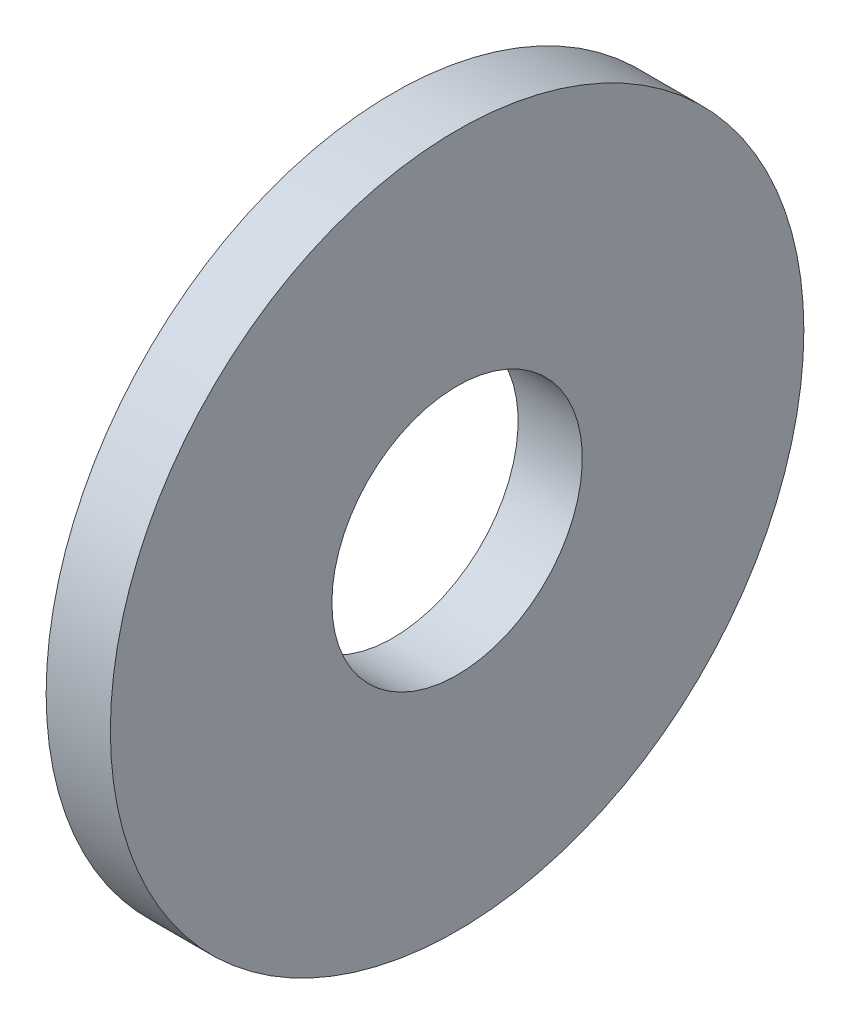
from build123d import *

# Parameters (mm, degrees)
SKETCH1_W = 10
SKETCH1_H = 34.5


with BuildPart() as part:
    # Sketch1 → Base-Revolve (revolve)
    with BuildSketch(Plane.XY):
        with Locations((-5, 36.75)):
            Rectangle(SKETCH1_W, SKETCH1_H)
    revolve(axis=Axis((-34.925, 0, 0), (1, 0, 0)))


solid = part.part
